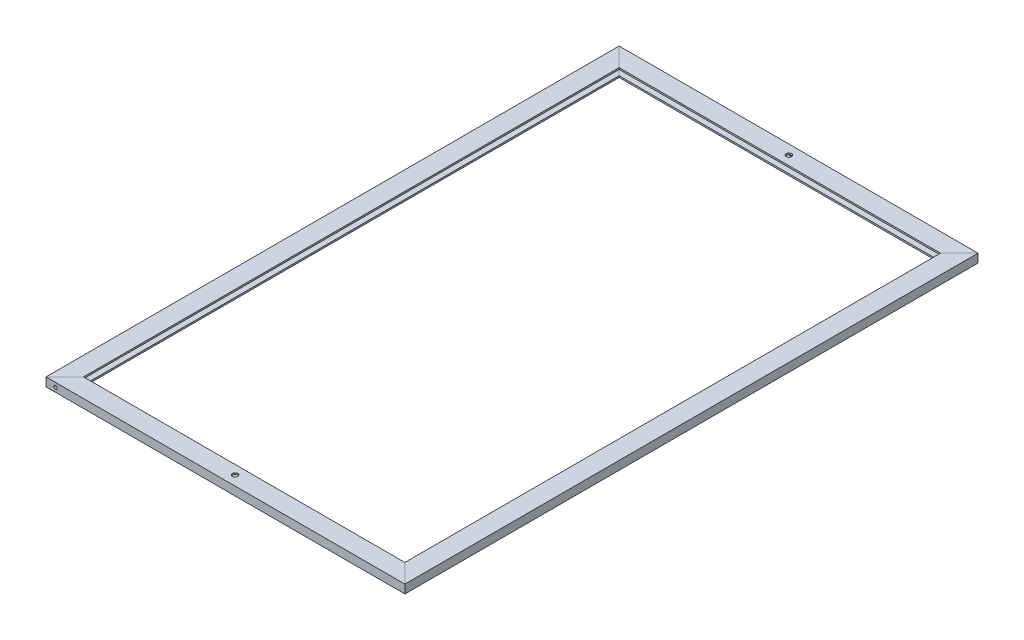
from build123d import *

# Parameters (mm, degrees)
SWEEP_START           = -16
SWEEP_1_OUTLINE_W     = 670
SWEEP_1_OUTLINE_H     = 1070
SWEEP_1_OUTLINE_W_2   = 600
SWEEP_1_OUTLINE_H_2   = 1000
SWEEP_1_DEPTH         = 3
SWEEP_START_2         = -3
SWEEP_1_2_OUTLINE_W   = 670
SWEEP_1_2_OUTLINE_H   = 1070
SWEEP_1_2_OUTLINE_W_2 = 600
SWEEP_1_2_OUTLINE_H_2 = 1000
SWEEP_1_2_DEPTH       = 3
SWEEP_START_3         = -13
SWEEP_1_3_OUTLINE_W   = 670
SWEEP_1_3_OUTLINE_H   = 1070
SWEEP_1_3_OUTLINE_W_2 = 660
SWEEP_1_3_OUTLINE_H_2 = 1060
SWEEP_1_3_DEPTH       = 10
SKETCH_16_R           = 3
CUT_EXTRUDE_1_DEPTH   = 1245.339583876
SKETCH_17_R           = 5
CUT_EXTRUDE_2_DEPTH   = 1215.374736233


# Read off the part's stored shape, not the designer's step: 扫描1
with BuildPart() as part:
    # 扫描1 outline → 扫描1 (new body)
    with BuildSketch(Plane(origin=(0, 0, 0), x_dir=(1, 0, 0), z_dir=(0, 1, 0)).offset(SWEEP_START)):
        with Locations((300, 500)):
            Rectangle(SWEEP_1_OUTLINE_W, SWEEP_1_OUTLINE_H)
        with Locations((300, 500)):
            Rectangle(SWEEP_1_OUTLINE_W_2, SWEEP_1_OUTLINE_H_2, mode=Mode.SUBTRACT)
    extrude(amount=SWEEP_1_DEPTH)



with BuildPart() as body_2:
    # Sweep 1 2 outline → Sweep 1 2 (new body)
    with BuildSketch(Plane(origin=(0, 0, 0), x_dir=(1, 0, 0), z_dir=(0, 1, 0)).offset(SWEEP_START_2)):
        with Locations((300, 500)):
            Rectangle(SWEEP_1_2_OUTLINE_W, SWEEP_1_2_OUTLINE_H)
        with Locations((300, 500)):
            Rectangle(SWEEP_1_2_OUTLINE_W_2, SWEEP_1_2_OUTLINE_H_2, mode=Mode.SUBTRACT)
    extrude(amount=SWEEP_1_2_DEPTH)


with BuildPart() as part_1:
    add(part.part)

    add(body_2.part)  # Sweep 1 3 merges body 2
    # Sweep 1 3 outline → Sweep 1 3 (add)
    with BuildSketch(Plane(origin=(0, 0, 0), x_dir=(1, 0, 0), z_dir=(0, 1, 0)).offset(SWEEP_START_3)):
        with Locations((300, 500)):
            Rectangle(SWEEP_1_3_OUTLINE_W, SWEEP_1_3_OUTLINE_H)
        with Locations((300, 500)):
            Rectangle(SWEEP_1_3_OUTLINE_W_2, SWEEP_1_3_OUTLINE_H_2, mode=Mode.SUBTRACT)
    extrude(amount=SWEEP_1_3_DEPTH)

    # 草图16 → 切除-拉伸1 (cut, through all)
    with BuildSketch(Plane.XY.offset(35)):
        with Locations((-17, -8)):
            Circle(SKETCH_16_R)
    extrude(amount=-CUT_EXTRUDE_1_DEPTH, mode=Mode.SUBTRACT)

    # 草图17 → 切除-拉伸2 (cut, through all)
    with BuildSketch(Plane(origin=(0, 0, 0), x_dir=(1, 0, 0), z_dir=(0, 1, 0))):
        with Locations(Location((300, 1017, 0), (0, 0, 270))):
            Circle(SKETCH_17_R)
        with Locations(Location((300, -17, 0), (0, 0, 270))):
            Circle(SKETCH_17_R)
    extrude(amount=-CUT_EXTRUDE_2_DEPTH, mode=Mode.SUBTRACT)


solid = part_1.part
